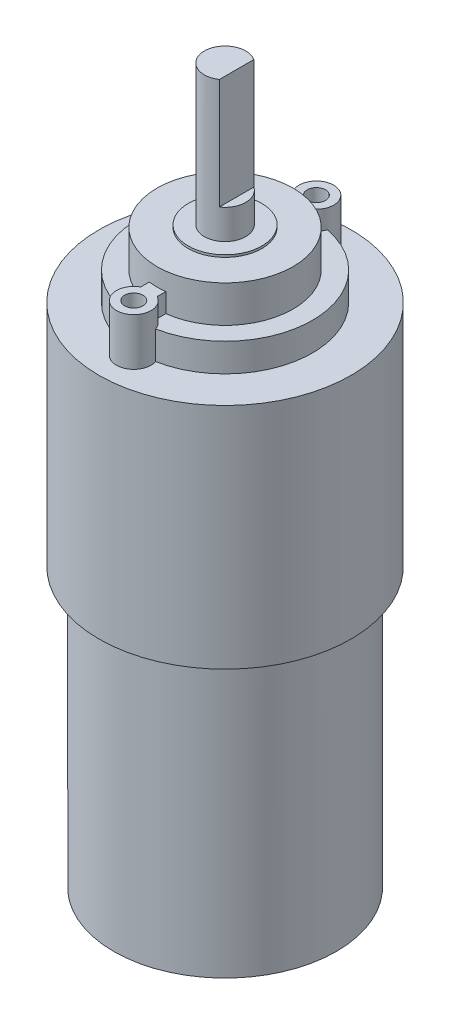
from build123d import *

# Parameters (mm, degrees)
FRONT_CYLINDER_SKETCH_R    = 13.7
FRONT_CYLINDER_DEPTH       = 24.81270946
MOUNTING_POINT_SKETCH_R    = 1
MOUNTING_POINTS_DEPTH      = 5.15
GEAR_MOUNT_BOTTOM_SKETCH_R = 9.5
GEAR_MOUNT_BOTTOM_DEPTH    = 3.074685726
GEAR_MOUNT_TOP_DEPTH       = 4
MOUNTING_HOLES_REACH       = 51.851
MOUNTING_HOLES_SKETCH_R    = 1
GEAR_DISK_SKETCH_R         = 4
GEAR_DISK_DEPTH            = 0.25
GEAR_SKETCH_R              = 2.25
GEAR_DEPTH                 = 15.225
GEAR_START                 = -12
GEAR_NOTCH_DEPTH           = 12
BACK_CYLINDER_SKETCH_R     = 12.1
BOSS_EXTRUDE7_DEPTH        = 30.2


with BuildPart() as part:
    # Front cylinder sketch → Front Cylinder (new body)
    with BuildSketch(Plane(origin=(0, 0, 0), x_dir=(1, 0, 0), z_dir=(0, 1, 0))):
        with Locations((10.070944868, -22.415974061)):
            Circle(FRONT_CYLINDER_SKETCH_R)
    extrude(amount=FRONT_CYLINDER_DEPTH)

    # Mounting Point Sketch → Mounting Points (add)
    # profile 1 of 2: a face of its own
    with BuildSketch(Plane(origin=(0, 24.81270946, 0), x_dir=(1, 0, 0), z_dir=(0, 1, 0))):
        with BuildLine():
            Line((10.970944868, -15.079824378), (10.970944868, -14.148518185))
            ThreePointArc((10.970944868, -14.148518185), (10.070944868, -10.614245578), (9.170944868, -14.148518185))
            Line((9.170944868, -14.148518185), (9.170944868, -15.079824378))
            ThreePointArc((9.170944868, -15.079824378), (10.070944868, -15.024824478), (10.970944868, -15.079824378))
        make_face()
        with Locations((10.070944868, -12.495974061)):
            Circle(MOUNTING_POINT_SKETCH_R, mode=Mode.SUBTRACT)
    # profile 2 of 2: a face of its own
    with BuildSketch(Plane(origin=(0, 24.81270946, 0), x_dir=(1, 0, 0), z_dir=(0, 1, 0))):
        with BuildLine():
            Line((9.170944868, -29.752123743), (9.170944868, -30.683429936))
            ThreePointArc((9.170944868, -30.683429936), (10.070944868, -34.217702543), (10.970944868, -30.683429936))
            Line((10.970944868, -30.683429936), (10.970944868, -29.752123743))
            ThreePointArc((10.970944868, -29.752123743), (10.070944868, -29.807123644), (9.170944868, -29.752123743))
        make_face()
        with Locations((10.070944868, -32.335974061)):
            Circle(MOUNTING_POINT_SKETCH_R, mode=Mode.SUBTRACT)
    extrude(amount=MOUNTING_POINTS_DEPTH)

    # Gear Mount Bottom Sketch → Gear Mount Bottom (add)
    with BuildSketch(Plane(origin=(0, 24.81270946, 0), x_dir=(1, 0, 0), z_dir=(0, 1, 0))):
        with Locations((10.070944868, -22.415974061)):
            Circle(GEAR_MOUNT_BOTTOM_SKETCH_R)
    extrude(amount=GEAR_MOUNT_BOTTOM_DEPTH)

    # Gear Mount Top Sketch → Gear Mount Top (add)
    with BuildSketch(Plane(origin=(0, 27.887395186, 0), x_dir=(1, 0, 0), z_dir=(0, 1, 0))):
        with BuildLine():
            ThreePointArc((17.462094451, -22.415974061), (15.606336759, -17.518165493), (10.970944868, -15.079824378))
            ThreePointArc((10.970944868, -15.079824378), (10.070944868, -15.024824478), (9.170944868, -15.079824378))
            ThreePointArc((9.170944868, -15.079824378), (2.679795285, -22.415974061), (9.170944868, -29.752123743))
            ThreePointArc((9.170944868, -29.752123743), (10.070944868, -29.807123644), (10.970944868, -29.752123743))
            ThreePointArc((10.970944868, -29.752123743), (15.606336759, -27.313782629), (17.462094451, -22.415974061))
        make_face()
    extrude(amount=GEAR_MOUNT_TOP_DEPTH)

    # Mounting Holes Sketch → Mounting Holes (cut, up to next)
    with BuildSketch(Plane(origin=(0, 24.81270946, 0), x_dir=(1, 0, 0), z_dir=(0, 1, 0)), mode=Mode.PRIVATE) as mounting_holes_sk1:
        with Locations((10.070944868, -12.495974061)):
            Circle(MOUNTING_HOLES_SKETCH_R)
    mounting_holes_tool1 = extrude(mounting_holes_sk1.sketch, amount=MOUNTING_HOLES_REACH, mode=Mode.PRIVATE) & part.part
    # Mounting Holes Sketch → Mounting Holes (cut, up to next)
    with BuildSketch(Plane(origin=(0, 24.81270946, 0), x_dir=(1, 0, 0), z_dir=(0, 1, 0)), mode=Mode.PRIVATE) as mounting_holes_sk2:
        with Locations((10.070944868, -32.335974061)):
            Circle(MOUNTING_HOLES_SKETCH_R)
    mounting_holes_tool2 = extrude(mounting_holes_sk2.sketch, amount=MOUNTING_HOLES_REACH, mode=Mode.PRIVATE) & part.part
    add(mounting_holes_tool1.solids().sort_by_distance((10.070945, 24.812709, 12.495974))[0], mode=Mode.SUBTRACT)
    add(mounting_holes_tool2.solids().sort_by_distance((10.070945, 24.812709, 32.335974))[0], mode=Mode.SUBTRACT)

    # Gear Disk Sketch → Gear disk (add)
    with BuildSketch(Plane(origin=(0, 31.887395186, 0), x_dir=(1, 0, 0), z_dir=(0, 1, 0))):
        with Locations((10.070944868, -22.415974061)):
            Circle(GEAR_DISK_SKETCH_R)
    extrude(amount=GEAR_DISK_DEPTH)

    # Gear Sketch → Gear (add)
    with BuildSketch(Plane(origin=(0, 32.137395186, 0), x_dir=(1, 0, 0), z_dir=(0, 1, 0))):
        with Locations((10.070944868, -22.415974061)):
            Circle(GEAR_SKETCH_R)
    extrude(amount=GEAR_DEPTH)

    # Gear Notch Sketch → Gear Notch (cut)
    with BuildSketch(Plane(origin=(0, 47.362395186, 0), x_dir=(1, 0, 0), z_dir=(0, 1, 0)).offset(GEAR_START)):
        with BuildLine():
            ThreePointArc((12.320944868, -22.415974061), (12.055258351, -21.355313889), (11.320944868, -20.545145367))
            Line((11.320944868, -20.545145367), (11.320944868, -24.286802754))
            ThreePointArc((11.320944868, -24.286802754), (12.055258351, -23.476634232), (12.320944868, -22.415974061))
        make_face()
    extrude(amount=GEAR_NOTCH_DEPTH, mode=Mode.SUBTRACT)

    # Back Cylinder Sketch → Boss-Extrude7 (add)
    with BuildSketch(Plane.XZ):
        with Locations((10.070944868, 22.415974061)):
            Circle(BACK_CYLINDER_SKETCH_R)
    extrude(amount=BOSS_EXTRUDE7_DEPTH)


solid = part.part
